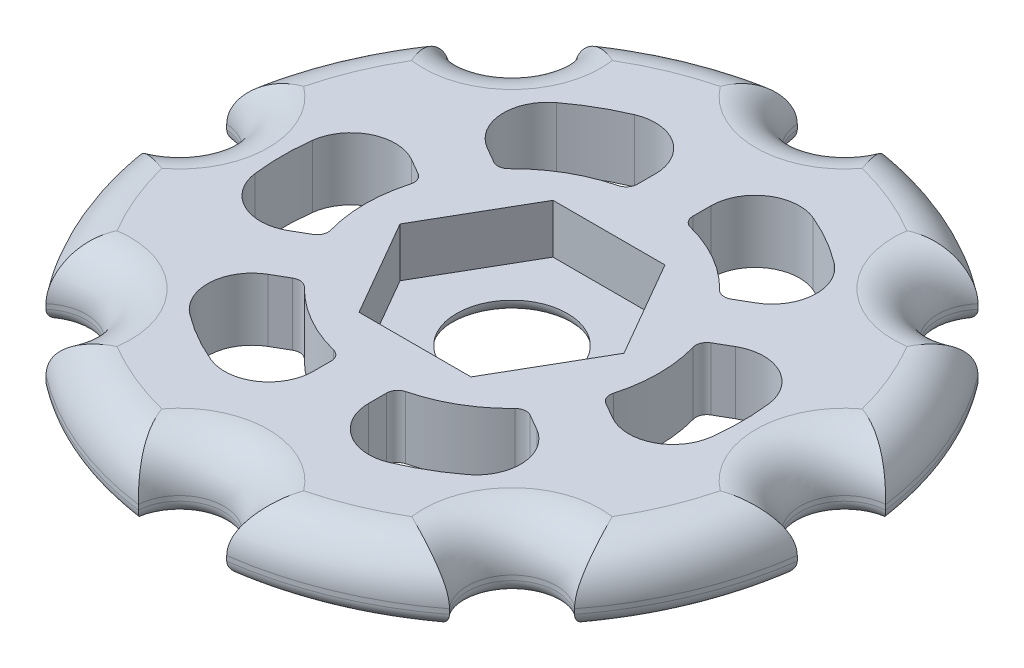
from build123d import *

# Parameters (mm, degrees)
CUT_EXTRUDE1_DEPTH = 2.8194
SKETCH4_R          = 3.175
CUT_EXTRUDE2_DEPTH = 28.08789427696439
CUT_EXTRUDE5_DEPTH = 28.17777448504568
FILLET1_R          = 2.54
FILLET2_R          = 0.762
CUT_EXTRUDE6_DEPTH = 27.94040797360171
FILLET3_R          = 2.54
FILLET14_R         = 0.635


with BuildPart() as part:
    # Sketch2 → Revolve1 (revolve)
    with BuildSketch(Plane.XY, mode=Mode.PRIVATE) as revolve1_sk:
        Polygon((0, 3.5813999999999995), (0, 0), (19.05, 1.3e-15), (19.05, 3.581400000000001), align=None)
    revolve(revolve1_sk.sketch.rotate(Axis((0, 0, 0), (0, 1, 0)), 90), axis=Axis((0, 0, 0), (0, 1, 0)))

    # Sketch3 → Cut-Extrude1 (cut)
    with BuildSketch(Plane(origin=(0, 3.5814000000000004, 0), x_dir=(1, 0, 0), z_dir=(0, 1, 0))):
        Polygon((3.207902433184857, 5.556249999999999), (-3.207902433184859, 5.556249999999999), (-6.415804866369715, 1.73e-15), (-3.207902433184856, -5.5562499999999995), (3.2079024331848567, -5.5562499999999995), (6.415804866369716, 1.55e-15), align=None)
    extrude(amount=-CUT_EXTRUDE1_DEPTH, mode=Mode.SUBTRACT)

    # Sketch4 → Cut-Extrude2 (cut, through all)
    with BuildSketch(Plane(origin=(0, 0.7620000000000001, 0), x_dir=(1, 0, 0), z_dir=(0, 1, 0))):
        with Locations(Location((0, 0, 0), (0, 0, 270))):
            Circle(SKETCH4_R)
    extrude(amount=-CUT_EXTRUDE2_DEPTH, mode=Mode.SUBTRACT)

    # Sketch6 → Cut-Extrude5 (cut, through all)
    with BuildSketch(Plane(origin=(0, 3.5814000000000004, 0), x_dir=(1, 0, 0), z_dir=(0, 1, 0))):
        with BuildLine():
            ThreePointArc((-15.142702988017227, 11.558591878628391), (-11.674332957389902, 11.674332957389902), (-11.558591878628395, 15.142702988017225))
            ThreePointArc((-11.558591878628395, 15.142702988017229), (-13.470384181603732, 13.470384181603734), (-15.14270298801723, 11.55859187862839))
        make_face()
        with BuildLine():
            ThreePointArc((-18.88066666666667, -2.5343492699748835), (-16.510000000000005, -3.6e-16), (-18.88066666666667, 2.534349269974883))
            ThreePointArc((-18.88066666666667, 2.534349269974884), (-19.050000000000004, 2.33e-15), (-18.880666666666674, -2.53434926997488))
        make_face()
        with BuildLine():
            ThreePointArc((-15.142702988017234, -11.558591878628388), (-13.470384181603736, -13.470384181603732), (-11.558591878628393, -15.14270298801723))
            ThreePointArc((-11.558591878628397, -15.142702988017227), (-11.674332957389904, -11.6743329573899), (-15.14270298801723, -11.558591878628395))
        make_face()
        with BuildLine():
            ThreePointArc((2.5343492699748795, -18.880666666666666), (1.735150329702519, -17.19504627191587), (8.371e-14, -16.51))
            Line((0, -16.51), (0, -19.050000000000008))
            ThreePointArc((3.349e-13, -19.050000000000004), (1.2700000000001606, -19.007619524811616), (2.53434926997487, -18.880666666666674))
        make_face()
        with BuildLine():
            Line((0, -19.050000000000008), (0, -16.51))
            ThreePointArc((8.371e-14, -16.51), (-1.7351503297024633, -17.19504627191581), (-2.5343492699748884, -18.880666666666666))
            ThreePointArc((-2.534349269974894, -18.88066666666667), (-1.269999999999847, -19.007619524811638), (3.349e-13, -19.050000000000004))
        make_face()
        with BuildLine():
            ThreePointArc((15.14270298801722, -11.558591878628393), (11.674332957389895, -11.674332957389902), (11.558591878628388, -15.142702988017227))
            ThreePointArc((11.558591878628386, -15.142702988017234), (13.47038418160372, -13.47038418160375), (15.14270298801722, -11.558591878628407))
        make_face()
        with BuildLine():
            ThreePointArc((19.050000000000004, 0), (19.007619524811627, 1.2699999999999998), (18.880666666666674, 2.5343492699748826))
            ThreePointArc((18.880666666666663, 2.5343492699748813), (16.509999999999998, -1.86e-15), (18.880666666666663, -2.5343492699748853))
            ThreePointArc((18.88066666666667, -2.534349269974895), (19.007619524811624, -1.270000000000017), (19.050000000000004, -4.67e-15))
        make_face()
        with BuildLine():
            ThreePointArc((15.14270298801723, 11.558591878628393), (13.470384181603734, 13.470384181603732), (11.558591878628395, 15.142702988017229))
            ThreePointArc((11.558591878628393, 15.142702988017225), (11.6743329573899, 11.674332957389897), (15.142702988017229, 11.55859187862839))
        make_face()
        with BuildLine():
            ThreePointArc((2.534349269974883, 18.880666666666674), (1.2700000000001737, 19.007619524811613), (3.5225e-13, 19.050000000000004))
            Line((0, 19.050000000000004), (0, 16.509999999999998))
            ThreePointArc((-8.377e-14, 16.509999999999998), (1.7351503297024622, 17.195046271915807), (2.534349269974883, 18.880666666666666))
        make_face()
        with BuildLine():
            Line((0, 16.509999999999998), (0, 19.050000000000004))
            ThreePointArc((3.5225e-13, 19.050000000000004), (-1.2699999999998253, 19.007619524811638), (-2.534349269974885, 18.88066666666667))
            ThreePointArc((-2.534349269974885, 18.88066666666667), (-1.7351503297025257, 17.195046271915864), (-8.377e-14, 16.509999999999998))
        make_face()
    extrude(amount=-CUT_EXTRUDE5_DEPTH, mode=Mode.SUBTRACT)

    # Fillet1
    fillet1_edges = [part.edges().sort_by_distance(p)[0] for p in [
        (17.599905094340016, 3.581400000000001, -7.290119386554947),
        (17.59990509434001, 3.581400000000001, 7.290119386554973),
        (7.290119386554948, 3.581400000000001, 17.599905094340016),
        (-7.290119386554965, 3.581400000000001, 17.599905094340013),
        (-17.599905094340013, 3.581400000000001, 7.290119386554958),
        (-17.599905094340016, 3.581400000000001, -7.290119386554959),
        (-7.290119386554961, 3.581400000000001, -17.599905094340013),
        (7.2901193865549585, 3.581400000000001, -17.599905094340016),
        (-16.510000000000005, 3.5814000000000004, 6.4e-16),
        (-11.674332957389904, 3.5814000000000004, 11.6743329573899),
        (1.1e-16, 3.5814000000000004, 16.51),
        (11.674332957389893, 3.5814000000000004, 11.674332957389902),
        (16.509999999999998, 3.5814000000000004, 1.58e-15),
        (11.6743329573899, 3.5814000000000004, -11.674332957389897),
        (1.55e-15, 3.5814000000000004, -16.509999999999998),
        (-11.674332957389902, 3.5814000000000004, -11.6743329573899),
    ]]
    fillet(fillet1_edges, radius=FILLET1_R - 0.0001)  # a hair under: the kernel refuses the full size

    # Fillet2
    fillet2_edges = [part.edges().sort_by_distance(p)[0] for p in [
        (9.7e-16, 0, -3.175),
        (17.599905094339935, 1.3e-15, -7.29011938655515),
        (17.59990509433993, 1.3e-15, 7.29011938655516),
        (7.290119386555027, 1.3e-15, 17.599905094339984),
        (-7.290119386555043, 1.3e-15, 17.59990509433998),
        (-17.599905094339938, 1.3e-15, 7.290119386555145),
        (-17.59990509433993, 1.3e-15, -7.290119386555155),
        (-7.290119386554916, 1.3e-15, -17.59990509434003),
        (7.290119386554911, 1.3e-15, -17.599905094340034),
        (-16.510000000000005, 0, 6.4e-16),
        (-11.674332957389904, 0, 11.6743329573899),
        (-8.38e-15, 0, 16.51),
        (11.674332957389895, 0, 11.6743329573899),
        (16.509999999999998, 0, 1.58e-15),
        (11.6743329573899, 0, -11.674332957389897),
        (1.34e-15, 0, -16.509999999999998),
        (-11.674332957389902, 0, -11.6743329573899),
    ]]
    fillet(fillet2_edges, radius=FILLET2_R - 0.0001)  # a hair under: the kernel refuses the full size

    # Sketch7 → Cut-Extrude6 (cut, through all)
    with BuildSketch(Plane.XZ):
        with BuildLine():
            ThreePointArc((-6.361896344627091, 5.506129671804003), (-4.206875000000002, 7.28652124109132), (-1.5874999999999986, 8.262628686592421))
            Line((-1.587499999999999, 8.262628686592423), (-1.5874999999999992, 13.080267879997718))
            ThreePointArc((-1.5874999999999986, 13.080267879997717), (-6.5881250000000025, 11.410967226614707), (-10.534094272383653, 7.914949268506647))
            Line((-10.534094272383653, 7.914949268506648), (-6.361896344627091, 5.506129671804002))
        make_face()
        with BuildLine():
            Line((1.5875000000000006, 13.08026787999772), (1.5875000000000008, 8.26262868659242))
            ThreePointArc((1.5875000000000012, 8.262628686592421), (4.206875000000001, 7.286521241091321), (6.3618963446270875, 5.506129671804007))
            Line((6.3618963446270875, 5.506129671804007), (10.534094272383646, 7.914949268506655))
            ThreePointArc((10.534094272383646, 7.914949268506656), (6.588124999999998, 11.41096722661471), (1.5875000000000001, 13.080267879997717))
        make_face()
        with BuildLine():
            ThreePointArc((-7.949396344627087, -2.7564990147884165), (-8.41375, -2.71e-15), (-7.94939634462709, 2.756499014788411))
            Line((-7.94939634462709, 2.7564990147884094), (-12.12159427238365, 5.165318611491054))
            ThreePointArc((-12.12159427238365, 5.165318611491054), (-13.17625, -1.009e-14), (-12.121594272383645, -5.165318611491068))
            Line((-12.121594272383648, -5.1653186114910685), (-7.949396344627086, -2.7564990147884165))
        make_face()
        with BuildLine():
            Line((12.121594272383648, 5.165318611491064), (7.949396344627088, 2.756499014788414))
            ThreePointArc((7.949396344627089, 2.756499014788414), (8.413750000000002, 4.4e-16), (7.949396344627089, -2.7564990147884134))
            Line((7.949396344627088, -2.7564990147884134), (12.121594272383648, -5.165318611491061))
            ThreePointArc((12.121594272383648, -5.165318611491061), (13.17625, 8.9e-16), (12.121594272383646, 5.165318611491064))
        make_face()
        with BuildLine():
            ThreePointArc((-1.5875000000000006, -8.262628686592421), (-4.206874999999997, -7.2865212410913225), (-6.3618963446270875, -5.506129671804008))
            Line((-6.361896344627087, -5.50612967180401), (-10.534094272383644, -7.914949268506659))
            ThreePointArc((-10.534094272383644, -7.91494926850666), (-6.5881249999999945, -11.410967226614712), (-1.5874999999999988, -13.080267879997717))
            Line((-1.5874999999999988, -13.08026787999772), (-1.5874999999999997, -8.26262868659242))
        make_face()
        with BuildLine():
            Line((10.534094272383651, -7.914949268506655), (6.3618963446270875, -5.506129671804005))
            ThreePointArc((6.361896344627086, -5.506129671804009), (4.206874999999995, -7.286521241091324), (1.5874999999999977, -8.262628686592421))
            Line((1.5875000000000001, -8.262628686592423), (1.587500000000001, -13.080267879997718))
            ThreePointArc((1.587499999999994, -13.080267879997718), (6.588124999999991, -11.410967226614714), (10.534094272383644, -7.914949268506658))
        make_face()
    extrude(amount=-CUT_EXTRUDE6_DEPTH, mode=Mode.SUBTRACT)

    # Fillet3
    fillet3_edges = [part.edges().sort_by_distance(p)[0] for p in [
        (-10.534094272383653, 1.7907000000000004, 7.914949268506649),
        (-1.5874999999999988, 1.7907000000000004, 13.080267879997717),
        (-12.121594272383646, 1.7907000000000004, -5.165318611491068),
        (-12.12159427238365, 1.7907000000000004, 5.165318611491054),
        (-1.5875000000000004, 1.7907000000000004, -13.080267879997717),
        (-10.534094272383644, 1.7907000000000004, -7.914949268506659),
        (10.534094272383648, 1.7907000000000004, -7.914949268506658),
        (1.5874999999999977, 1.7907000000000004, -13.08026787999772),
        (12.121594272383646, 1.7907000000000004, 5.165318611491064),
        (12.12159427238365, 1.7907000000000004, -5.165318611491061),
        (1.5875000000000008, 1.7907000000000004, 13.080267879997718),
        (10.534094272383646, 1.7907000000000004, 7.914949268506655),
    ]]
    fillet(fillet3_edges, radius=FILLET3_R)

    # Fillet14
    fillet14_edges = [part.edges().sort_by_distance(p)[0] for p in [
        (-1.5874999999999986, 1.7907000000000004, 8.262628686592421),
        (-6.361896344627091, 1.7907000000000004, 5.506129671804002),
        (-7.94939634462709, 1.7907000000000004, 2.75649901478841),
        (-7.949396344627086, 1.7907000000000004, -2.7564990147884165),
        (-6.3618963446270875, 1.7907000000000004, -5.506129671804009),
        (-1.5875000000000004, 1.7907000000000004, -8.262628686592421),
        (1.5874999999999986, 1.7907000000000004, -8.262628686592421),
        (6.361896344627087, 1.7907000000000004, -5.506129671804008),
        (7.949396344627088, 1.7907000000000004, -2.7564990147884134),
        (7.949396344627088, 1.7907000000000004, 2.756499014788414),
        (6.3618963446270875, 1.7907000000000004, 5.506129671804007),
        (1.5875000000000012, 1.7907000000000004, 8.262628686592421),
    ]]
    fillet(fillet14_edges, radius=FILLET14_R)


solid = part.part
